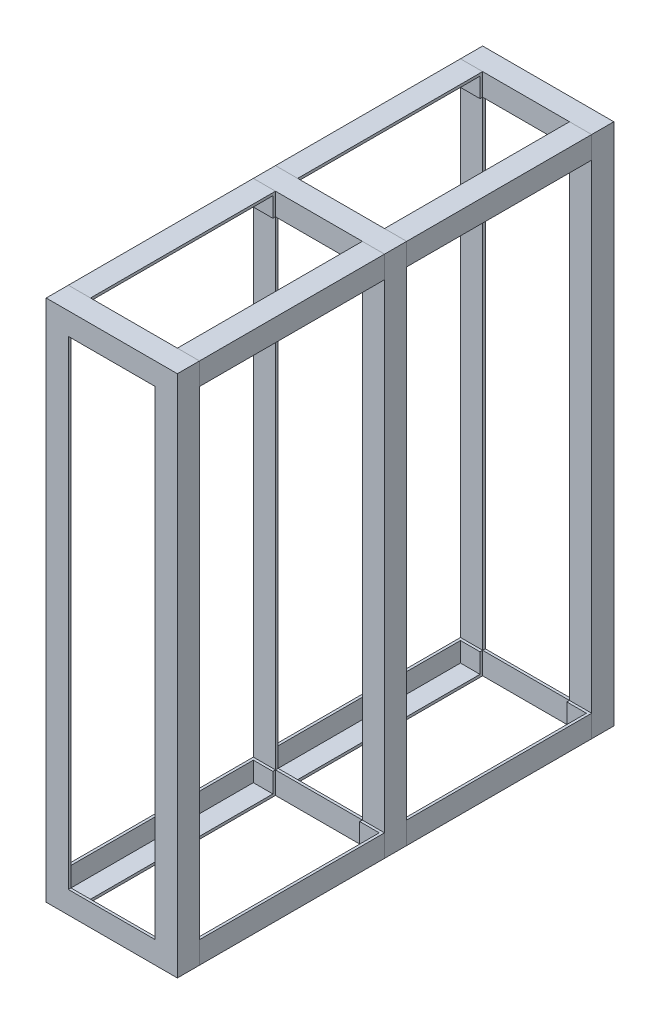
from build123d import *

# Parameters (mm, degrees)
SKETCH1_W             = 25.4
SKETCH1_H             = 25.4
BOSS_EXTRUDE1_DEPTH   = 600
SKETCH2_W             = 25.4
SKETCH2_H             = 25.4
BOSS_EXTRUDE2_DEPTH   = 125
SKETCH3_W             = 25.4
SKETCH3_H             = 25.4
BOSS_EXTRUDE3_DEPTH   = 574.6
SKETCH4_W             = 150.4
SKETCH4_H             = 25.4
BOSS_EXTRUDE4_DEPTH   = 25.4
SKETCH5_W             = 25.4
SKETCH5_H             = 25.4
BOSS_EXTRUDE5_DEPTH   = 212.1
BOSS_EXTRUDE5_2_DEPTH = 212.1
BOSS_EXTRUDE5_3_DEPTH = 212.1
BOSS_EXTRUDE5_4_DEPTH = 212.1
SKETCH6_W             = 150.4
SKETCH6_H             = 600
SKETCH6_W_2           = 99.6
SKETCH6_H_2           = 549.2
BOSS_EXTRUDE6_DEPTH   = 25.4
SKETCH7_W             = 25.4
SKETCH7_H             = 25.4
BOSS_EXTRUDE7_DEPTH   = 212.1
BOSS_EXTRUDE7_2_DEPTH = 212.1
BOSS_EXTRUDE7_3_DEPTH = 212.1
BOSS_EXTRUDE7_4_DEPTH = 212.1
SKETCH9_W             = 150.4
SKETCH9_H             = 600
SKETCH9_W_2           = 99.6
SKETCH9_H_2           = 549.2
BOSS_EXTRUDE8_DEPTH   = 25.4
SHELL2_T              = -3
SHELL3_T              = -3
SHELL4_T              = -3
SHELL5_T              = -3
SHELL6_T              = -3
SHELL7_T              = -3
SHELL8_T              = -3
SHELL9_T              = -3
SHELL10_T             = -3
SHELL11_T             = -3
SHELL12_T             = -3


with BuildPart() as part:
    # Sketch1 → Boss-Extrude1 (new body)
    with BuildSketch(Plane(origin=(0, 0, 0), x_dir=(1, 0, 0), z_dir=(0, 1, 0))):
        Rectangle(SKETCH1_W, SKETCH1_H)
    extrude(amount=BOSS_EXTRUDE1_DEPTH)

    # Sketch2 → Boss-Extrude2 (add)
    with BuildSketch(Plane.ZY.offset(12.7)):
        with Locations((0, 587.3)):
            Rectangle(SKETCH2_W, SKETCH2_H)
    extrude(amount=BOSS_EXTRUDE2_DEPTH)

    # Sketch3 → Boss-Extrude3 (add)
    with BuildSketch(Plane(origin=(0, 574.6, 0), x_dir=(-1, 0, 0), z_dir=(0, -1, 0))):
        with Locations((125, 0)):
            Rectangle(SKETCH3_W, SKETCH3_H)
    extrude(amount=BOSS_EXTRUDE3_DEPTH)

    # Sketch4 → Boss-Extrude4 (add)
    with BuildSketch(Plane(origin=(0, 0, -12.7), x_dir=(-1, 0, 0), z_dir=(0, 0, -1))):
        with Locations((62.5, 12.7)):
            Rectangle(SKETCH4_W, SKETCH4_H)
    extrude(amount=-BOSS_EXTRUDE4_DEPTH)

    # Shell2
    shell2_openings = [part.faces().sort_by_distance(p)[0] for p in [
        (-112.3, 300, 0),
        (-62.5, 574.6, 0),
        (-62.5, 25.4, 0),
        (-12.7, 300, 0),
        (-62.5, 6.185629798, -12.7),
    ]]
    offset(amount=SHELL2_T, openings=shell2_openings, kind=Kind.INTERSECTION)


with BuildPart() as body_2:
    # Sketch5 → Boss-Extrude5 (new body)
    with BuildSketch(Plane(origin=(0, 0, -12.7), x_dir=(-1, 0, 0), z_dir=(0, 0, -1))):
        with Locations((0, 587.3)):
            Rectangle(SKETCH5_W, SKETCH5_H)
    extrude(amount=BOSS_EXTRUDE5_DEPTH)

    # Shell3
    shell3_openings = [body_2.faces().sort_by_distance(p)[0] for p in [
        (0, 587.3, -12.7),
        (0, 574.6, -118.75),
        (-12.7, 587.3, -118.75),
    ]]
    offset(amount=SHELL3_T, openings=shell3_openings, kind=Kind.INTERSECTION)


with BuildPart() as body_3:
    # Sketch5 → Boss-Extrude5 2 (new body)
    with BuildSketch(Plane(origin=(0, 0, -12.7), x_dir=(-1, 0, 0), z_dir=(0, 0, -1))):
        with Locations((125, 587.3)):
            Rectangle(SKETCH5_W, SKETCH5_H)
    extrude(amount=BOSS_EXTRUDE5_2_DEPTH)

    # Shell4
    shell4_openings = [body_3.faces().sort_by_distance(p)[0] for p in [
        (-125, 587.3, -12.7),
        (-112.3, 587.3, -118.75),
        (-125, 574.6, -118.75),
    ]]
    offset(amount=SHELL4_T, openings=shell4_openings, kind=Kind.INTERSECTION)


with BuildPart() as body_4:
    # Sketch5 → Boss-Extrude5 3 (new body)
    with BuildSketch(Plane(origin=(0, 0, -12.7), x_dir=(-1, 0, 0), z_dir=(0, 0, -1))):
        with Locations((0, 12.7)):
            Rectangle(SKETCH5_W, SKETCH5_H)
    extrude(amount=BOSS_EXTRUDE5_3_DEPTH)

    # Shell5
    shell5_openings = [body_4.faces().sort_by_distance(p)[0] for p in [
        (0, 12.7, -12.7),
        (-12.7, 12.7, -118.75),
        (0, 25.4, -118.75),
    ]]
    offset(amount=SHELL5_T, openings=shell5_openings, kind=Kind.INTERSECTION)


with BuildPart() as body_5:
    # Sketch5 → Boss-Extrude5 4 (new body)
    with BuildSketch(Plane(origin=(0, 0, -12.7), x_dir=(-1, 0, 0), z_dir=(0, 0, -1))):
        with Locations((125, 12.7)):
            Rectangle(SKETCH5_W, SKETCH5_H)
    extrude(amount=BOSS_EXTRUDE5_4_DEPTH)

    # Shell6
    shell6_openings = [body_5.faces().sort_by_distance(p)[0] for p in [
        (-125, 12.7, -12.7),
        (-112.3, 12.7, -118.75),
        (-125, 25.4, -118.75),
    ]]
    offset(amount=SHELL6_T, openings=shell6_openings, kind=Kind.INTERSECTION)


with BuildPart() as body_6:
    # Sketch6 → Boss-Extrude6 (new body)
    with BuildSketch(Plane(origin=(0, 0, -224.8), x_dir=(-1, 0, 0), z_dir=(0, 0, -1))):
        with Locations((62.5, 300)):
            Rectangle(SKETCH6_W, SKETCH6_H)
        with Locations((62.5, 300)):
            Rectangle(SKETCH6_W_2, SKETCH6_H_2, mode=Mode.SUBTRACT)
    extrude(amount=BOSS_EXTRUDE6_DEPTH)

    # Shell7
    shell7_openings = [body_6.faces().sort_by_distance(p)[0] for p in [
        (-62.5, 6.185629798, -250.2),
        (-112.3, 300, -237.5),
        (-62.5, 25.4, -237.5),
        (-12.7, 300, -237.5),
        (-62.5, 574.6, -237.5),
    ]]
    offset(amount=SHELL7_T, openings=shell7_openings, kind=Kind.INTERSECTION)


with BuildPart() as body_7:
    # Sketch7 → Boss-Extrude7 (new body)
    with BuildSketch(Plane(origin=(0, 0, -250.2), x_dir=(-1, 0, 0), z_dir=(0, 0, -1))):
        with Locations((0, 587.3)):
            Rectangle(SKETCH7_W, SKETCH7_H)
    extrude(amount=BOSS_EXTRUDE7_DEPTH)

    # Shell9
    shell9_openings = [body_7.faces().sort_by_distance(p)[0] for p in [
        (0, 587.3, -250.2),
        (-12.7, 587.3, -356.25),
        (0, 574.6, -356.25),
    ]]
    offset(amount=SHELL9_T, openings=shell9_openings, kind=Kind.INTERSECTION)


with BuildPart() as body_8:
    # Sketch7 → Boss-Extrude7 2 (new body)
    with BuildSketch(Plane(origin=(0, 0, -250.2), x_dir=(-1, 0, 0), z_dir=(0, 0, -1))):
        with Locations((125, 587.3)):
            Rectangle(SKETCH7_W, SKETCH7_H)
    extrude(amount=BOSS_EXTRUDE7_2_DEPTH)

    # Shell8
    shell8_openings = [body_8.faces().sort_by_distance(p)[0] for p in [
        (-125, 574.6, -356.25),
        (-112.3, 587.3, -356.25),
        (-125, 587.3, -250.2),
    ]]
    offset(amount=SHELL8_T, openings=shell8_openings, kind=Kind.INTERSECTION)


with BuildPart() as body_9:
    # Sketch7 → Boss-Extrude7 3 (new body)
    with BuildSketch(Plane(origin=(0, 0, -250.2), x_dir=(-1, 0, 0), z_dir=(0, 0, -1))):
        with Locations((0, 12.7)):
            Rectangle(SKETCH7_W, SKETCH7_H)
    extrude(amount=BOSS_EXTRUDE7_3_DEPTH)

    # Shell10
    shell10_openings = [body_9.faces().sort_by_distance(p)[0] for p in [
        (0, 25.4, -356.25),
        (-12.7, 12.7, -356.25),
        (0, 12.7, -250.2),
    ]]
    offset(amount=SHELL10_T, openings=shell10_openings, kind=Kind.INTERSECTION)


with BuildPart() as body_10:
    # Sketch7 → Boss-Extrude7 4 (new body)
    with BuildSketch(Plane(origin=(0, 0, -250.2), x_dir=(-1, 0, 0), z_dir=(0, 0, -1))):
        with Locations((125, 12.7)):
            Rectangle(SKETCH7_W, SKETCH7_H)
    extrude(amount=BOSS_EXTRUDE7_4_DEPTH)

    # Shell11
    shell11_openings = [body_10.faces().sort_by_distance(p)[0] for p in [
        (-125, 12.7, -250.2),
        (-125, 25.4, -356.25),
        (-112.3, 12.7, -356.25),
    ]]
    offset(amount=SHELL11_T, openings=shell11_openings, kind=Kind.INTERSECTION)


with BuildPart() as body_11:
    # Sketch9 → Boss-Extrude8 (new body)
    with BuildSketch(Plane(origin=(0, 0, -462.3), x_dir=(-1, 0, 0), z_dir=(0, 0, -1))):
        with Locations((62.5, 300)):
            Rectangle(SKETCH9_W, SKETCH9_H)
        with Locations((62.5, 300)):
            Rectangle(SKETCH9_W_2, SKETCH9_H_2, mode=Mode.SUBTRACT)
    extrude(amount=BOSS_EXTRUDE8_DEPTH)

    # Shell12
    shell12_openings = [body_11.faces().sort_by_distance(p)[0] for p in [
        (-62.5, 574.6, -475),
        (-112.3, 300, -475),
        (-62.5, 25.4, -475),
        (-62.5, 6.185629798, -487.7),
        (-12.7, 300, -475),
    ]]
    offset(amount=SHELL12_T, openings=shell12_openings, kind=Kind.INTERSECTION)


solid = Compound([part.part, body_2.part, body_3.part, body_4.part, body_5.part, body_6.part, body_7.part, body_8.part, body_9.part, body_10.part, body_11.part])
